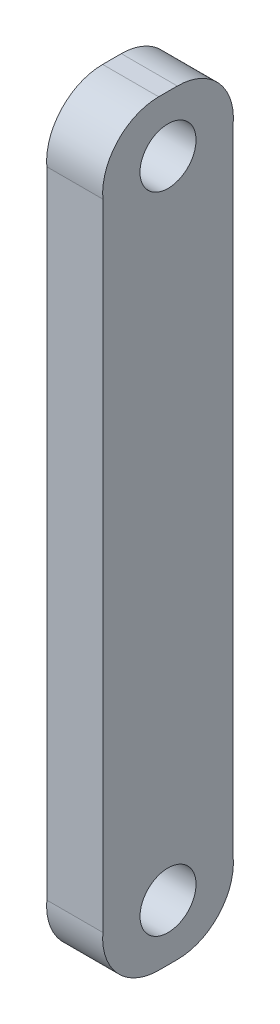
from build123d import *

# Parameters (mm, degrees)
SKETCH1_R           = 1.5
BOSS_EXTRUDE1_DEPTH = 3


with BuildPart() as part:
    # Sketch1 → Boss-Extrude1 (new body)
    with BuildSketch(Plane(origin=(0, 0, 0), x_dir=(0, 0, -1), z_dir=(1, 0, 0))):
        with BuildLine():
            Line((-0.5, -3), (0.5, -3))
            ThreePointArc((0.5, -3), (2.708238703, -2.030685064), (3.489491568, 0.250878781))
            Line((3.489491568, 0.250878781), (3.489491568, 34.250878781))
            ThreePointArc((3.489491568, 34.250878781), (2.708238703, 36.532442626), (0.5, 37.501757562))
            Line((0.5, 37.501757562), (-0.5, 37.501757562))
            ThreePointArc((-0.5, 37.501757562), (-2.708238703, 36.532442626), (-3.489491568, 34.250878781))
            Line((-3.489491568, 34.250878781), (-3.489491568, 0.250878781))
            ThreePointArc((-3.489491568, 0.250878781), (-2.708238703, -2.030685064), (-0.5, -3))
        make_face()
        Circle(SKETCH1_R, mode=Mode.SUBTRACT)
        with Locations((0, 34.501757562)):
            Circle(SKETCH1_R, mode=Mode.SUBTRACT)
    extrude(amount=BOSS_EXTRUDE1_DEPTH)


solid = part.part
